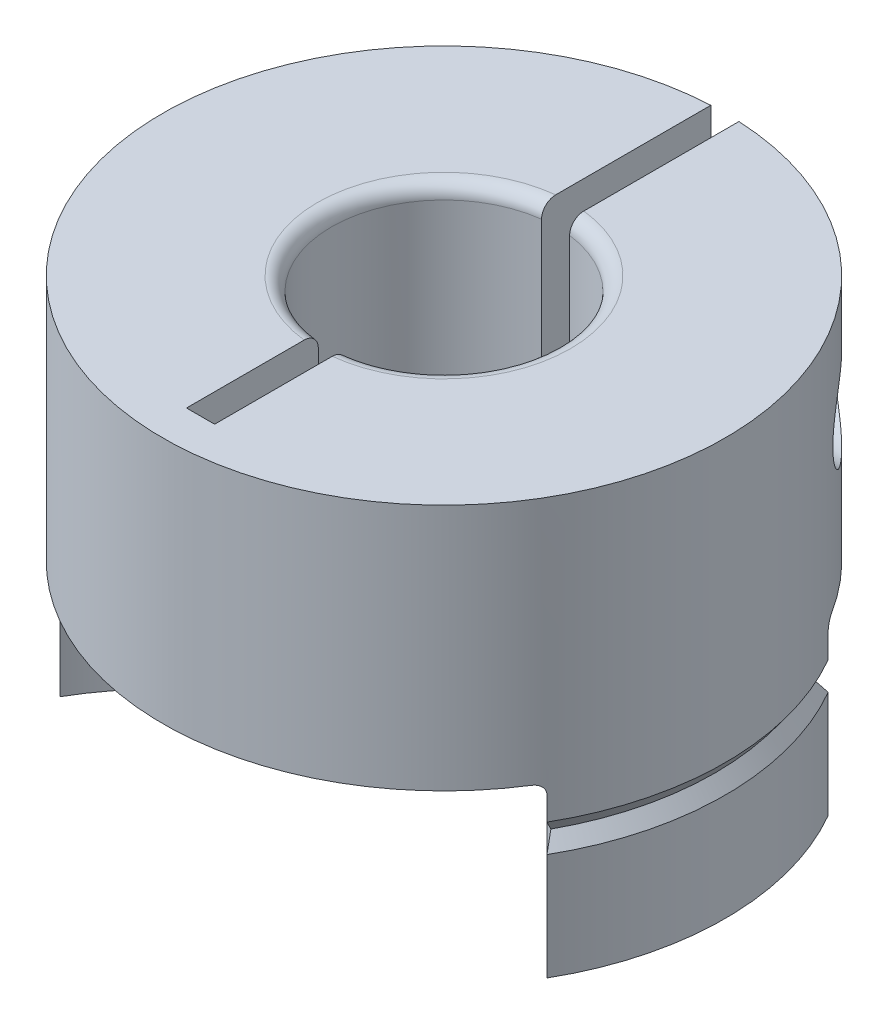
from build123d import *

# Parameters (mm, degrees)
SKETCH_1_R          = 10
EXTRUDE_1_DEPTH     = 8.8
EXTRUDE_START       = -6
EXTRUDE_2_DEPTH     = 6
SKETCH_2_R          = 4
CUT_EXTRUDE_1_DEPTH = 10
CUT_EXTRUDE_2_DEPTH = 10
CUT_EXTRUDE_3_DEPTH = 10
SKETCH_4_3_R        = 1.5
CUT_EXTRUDE_4_DEPTH = 20
CUT_EXTRUDE_5_DEPTH = 0.5
FILLET_1_R          = 0.35
FILLET_2_R          = 0.5
FILLET_3_R          = 0.5


with BuildPart() as part:
    # 草图1 → 凸台-拉伸1 (new body)
    with BuildSketch(Plane(origin=(0, 0, 0), x_dir=(1, 0, 0), z_dir=(0, 1, 0))):
        Circle(SKETCH_1_R)
    extrude(amount=EXTRUDE_1_DEPTH)

    # 草图1<3> → 凸台-拉伸2 (add)
    with BuildSketch(Plane(origin=(0, 0, 0), x_dir=(1, 0, 0), z_dir=(0, 1, 0)).offset(EXTRUDE_START)):
        with BuildLine():
            Line((-5, -1.339745962), (-5, 1.339745962))
            ThreePointArc((-5, 1.339745962), (-7.071067812, 2.928932188), (-8.660254038, 5))
            ThreePointArc((-8.660254038, 5), (-10, 0), (-8.660254038, -5))
            ThreePointArc((-8.660254038, -5), (-7.071067812, -2.928932188), (-5, -1.339745962))
        make_face()
        with BuildLine():
            ThreePointArc((8.660254038, -5), (10, 0), (8.660254038, 5))
            ThreePointArc((8.660254038, 5), (7.071067812, 2.928932188), (5, 1.339745962))
            Line((5, 1.339745962), (5, -1.339745962))
            ThreePointArc((5, -1.339745962), (7.071067812, -2.928932188), (8.660254038, -5))
        make_face()
    extrude(amount=EXTRUDE_2_DEPTH)

    # 草图2 → 切除-拉伸1 (cut)
    with BuildSketch(Plane.XZ):
        Circle(SKETCH_2_R)
    extrude(amount=-CUT_EXTRUDE_1_DEPTH, mode=Mode.SUBTRACT)

    # 草图3 → 切除-拉伸2 (cut)
    with BuildSketch(Plane.XZ):
        with BuildLine():
            Line((-0.5, -3.968626967), (-0.5, -9.987492178))
            ThreePointArc((-0.5, -9.987492178), (0, -10), (0.5, -9.987492178))
            Line((0.5, -9.987492178), (0.5, -3.968626967))
            ThreePointArc((0.5, -3.968626967), (0, -4), (-0.5, -3.968626967))
        make_face()
    extrude(amount=-CUT_EXTRUDE_2_DEPTH, mode=Mode.SUBTRACT)

    # 草图4 → 切除-拉伸3 (cut)
    with BuildSketch(Plane(origin=(-3, 0, 0), x_dir=(0, 0, -1), z_dir=(1, 0, 0))):
        with BuildLine():
            Line((8.987492178, 6.9), (8.987492178, 3.1))
            ThreePointArc((8.987492178, 3.1), (4.130795798, 5), (8.987492178, 6.9))
        make_face()
    extrude(amount=-CUT_EXTRUDE_3_DEPTH, mode=Mode.SUBTRACT)

    # 草图4<3> → 切除-拉伸4 (cut)
    with BuildSketch(Plane(origin=(-3, 0, 0), x_dir=(0, 0, -1), z_dir=(1, 0, 0))):
        with Locations((6.930795798, 5)):
            Circle(SKETCH_4_3_R)
    extrude(amount=CUT_EXTRUDE_4_DEPTH, mode=Mode.SUBTRACT)

    # 草图5 → 切除-拉伸5 (cut, symmetric)
    with BuildSketch(Plane(origin=(0, 0, 0), x_dir=(0, 0, -1), z_dir=(1, 0, 0))):
        with BuildLine():
            Line((-8.656253911, 8.8), (-0.006253911, 8.8))
            Line((-0.006253911, 8.8), (-0.006253911, -0.458881174))
            ThreePointArc((-0.006253911, -0.458881174), (-5.535658287, 3.0453589), (-8.656253911, 8.8))
        make_face()
    extrude(amount=CUT_EXTRUDE_5_DEPTH, both=True, mode=Mode.SUBTRACT)

    # 草图6 → 切除-旋转2 (revolve, cut)
    with BuildSketch(Plane.XY):
        Polygon((-10, -2.2), (-10, -1.2), (-9.636728736, -1.7), align=None)
    revolve(axis=Axis((0, 10, 0), (0, -1, 0)), mode=Mode.SUBTRACT)

    # 圆角1
    fillet_1_edges = [part.edges().sort_by_distance(p)[0] for p in [
        (7.071067812, 0, 2.928932188),
        (5, 0, 0),
        (7.071067812, 0, -2.928932188),
        (-7.071067812, 0, 2.928932188),
        (-5, 0, 0),
        (-7.071067812, 0, -2.928932188),
    ]]
    fillet(fillet_1_edges, radius=FILLET_1_R)

    # 圆角2
    fillet_2_edges = [part.edges().sort_by_distance(p)[0] for p in [
        (4, 8.8, 0),
        (-4, 8.8, 0),
    ]]
    fillet(fillet_2_edges, radius=FILLET_2_R)

    # 圆角3
    fillet_3_edges = [part.edges().sort_by_distance(p)[0] for p in [
        (0, 0, 4),
    ]]
    fillet(fillet_3_edges, radius=FILLET_3_R)


solid = part.part
